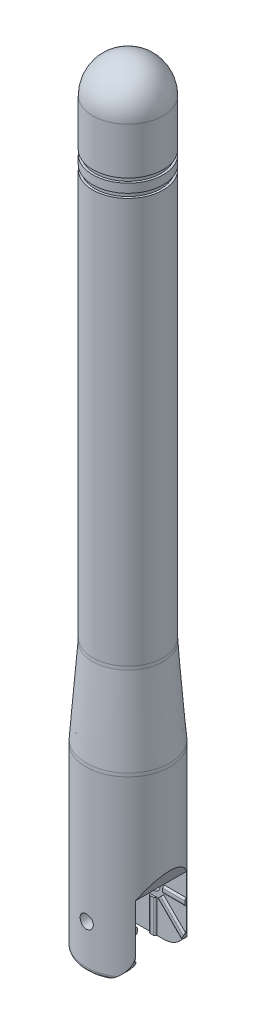
from build123d import *

# Parameters (mm, degrees)
ESQUISSE3_W                  = 7.5
ESQUISSE3_H                  = 5.8
ENL_V_MAT_EXTRU_1_DEPTH      = 8
CONG_1_R                     = 0.5
ENL_V_MAT_EXTRU_2_DEPTH      = 89.206964432
ENL_V_MAT_EXTRU_2_DEPTH_BACK = 89.206964432
ESQUISSE4_R                  = 0.75
ESQUISSE5_W                  = 0.75
ESQUISSE5_H                  = 3.75
ESQUISSE5_W_2                = 2.511980861
ESQUISSE5_H_2                = 0.75
BOSS_EXTRU_1_DEPTH           = 0.2
CONG_2_R                     = 0.2
CONG_2_OF_SYM_TRIE1_R        = 0.2
ENL_V_MAT_EXTRU_3_DEPTH      = 89.410568231


with BuildPart() as part:
    # Esquisse2 → Révolution1 (revolve)
    with BuildSketch(Plane.XY):
        with BuildLine():
            Line((4.014003451, 30.213287326), (4.735996549, 20.586712674))
            ThreePointArc((4.735996549, 20.586712674), (4.746497911, 20.399868856), (4.75, 20.212762933))
            Line((4.75, 20.212762933), (4.75, 0))
            Line((4.75, 0), (1, 0))
            Line((1, 0), (1, 83.950802))
            Line((1, 83.950802), (0, 83.950802))
            Line((0, 83.950802), (0, 87.950802))
            ThreePointArc((0, 87.950802), (2.828427125, 86.779229125), (4, 83.950802))
            Line((4, 83.950802), (4, 78.650802))
            Line((4, 78.650802), (3.75, 78.650802))
            Line((3.75, 78.650802), (3.75, 78.150802))
            Line((3.75, 78.150802), (4, 78.150802))
            Line((4, 78.150802), (4, 77.150802))
            Line((4, 77.150802), (3.75, 77.150802))
            Line((3.75, 77.150802), (3.75, 76.650802))
            Line((3.75, 76.650802), (4, 76.650802))
            Line((4, 76.650802), (4, 30.587237067))
            ThreePointArc((4, 30.587237067), (4.003502089, 30.400131144), (4.014003451, 30.213287326))
        make_face()
    revolve(axis=Axis((0, 0, 0), (0, 1, 0)))

    # Esquisse3 → Enlèv. mat.-Extru.1 (cut)
    with BuildSketch(Plane.XZ):
        with Locations((1, 0)):
            Rectangle(ESQUISSE3_W, ESQUISSE3_H)
    extrude(amount=-ENL_V_MAT_EXTRU_1_DEPTH, mode=Mode.SUBTRACT)

    # Congé1
    cong_1_edges = [part.edges().sort_by_distance(p)[0] for p in [
        (-4.75, 0, 0),
    ]]
    fillet(cong_1_edges, radius=CONG_1_R)

    # Esquisse4 → Enlèv. mat.-Extru.2 (cut, two sides: drawn at the far end of the back side and taken through both)
    with BuildSketch(Plane.XY.offset(-ENL_V_MAT_EXTRU_2_DEPTH_BACK)):
        with Locations((0, 5)):
            Circle(ESQUISSE4_R)
        with BuildLine():
            Line((1.161980861, 0), (3.761980861, 0))
            Line((3.761980861, 0), (3.761980861, 2.6))
            ThreePointArc((3.761980861, 2.6), (3.000458492, 0.761522369), (1.161980861, 0))
        make_face()
        Polygon((3.761980861, 8), (4.75, 10), (4.75, 8), align=None)
    extrude(amount=ENL_V_MAT_EXTRU_2_DEPTH + ENL_V_MAT_EXTRU_2_DEPTH_BACK, mode=Mode.SUBTRACT)

    # Esquisse5 → Boss.-Extru.1 (add)
    with BuildSketch(Plane.XY.offset(-2.9)):
        with Locations((0, 1.875)):
            Rectangle(ESQUISSE5_W, ESQUISSE5_H)
        Polygon((0.618718434, 3.850951481), (1.149048519, 4.381281566), (4.027145904, 1.503184182), (3.496815818, 0.972854096), align=None)
        with Locations((2.50599043, 5)):
            Rectangle(ESQUISSE5_W_2, ESQUISSE5_H_2)
    boss_extru_1 = extrude(amount=BOSS_EXTRU_1_DEPTH)

    # Congé2
    cong_2_edges = [part.edges().sort_by_distance(p)[0] for p in [
        (2.505990431, 5.375, -2.7),
        (2.505990431, 4.625, -2.7),
        (2.588097212, 2.942232874, -2.7),
        (2.057767126, 2.411902788, -2.7),
        (-0.375, 1.875, -2.7),
        (0.375, 1.875, -2.7),
    ]]
    fillet(cong_2_edges, radius=CONG_2_R - 0.0001)  # a hair under: the kernel refuses the full size

    # Symétrie1: Boss.-Extru.1 across plane
    add(boss_extru_1.mirror(Plane.XY))

    # Congé2 of Symétrie1
    cong_2_of_sym_trie1_edges = [part.edges().sort_by_distance(p)[0] for p in [
        (2.505990431, 5.375, 2.7),
        (2.505990431, 4.625, 2.7),
        (2.588097212, 2.942232874, 2.7),
        (2.057767126, 2.411902788, 2.7),
        (-0.375, 1.875, 2.7),
        (0.375, 1.875, 2.7),
    ]]
    fillet(cong_2_of_sym_trie1_edges, radius=CONG_2_OF_SYM_TRIE1_R - 0.0001)  # a hair under: the kernel refuses the full size

    # Esquisse6 → Enlèv. mat.-Extru.3 (cut, through all)
    with BuildSketch(Plane.XY.offset(2.9)):
        with BuildLine():
            Line((4.027145904, 1.503184182), (3.658059706, 1.87227038))
            ThreePointArc((3.658059706, 1.87227038), (3.516870908, 1.49795968), (3.319930166, 1.149739748))
            Line((3.319930166, 1.149739748), (3.496815818, 0.972854096))
            Line((3.496815818, 0.972854096), (4.027145904, 1.503184182))
        make_face()
    extrude(amount=-ENL_V_MAT_EXTRU_3_DEPTH, mode=Mode.SUBTRACT)


solid = part.part
